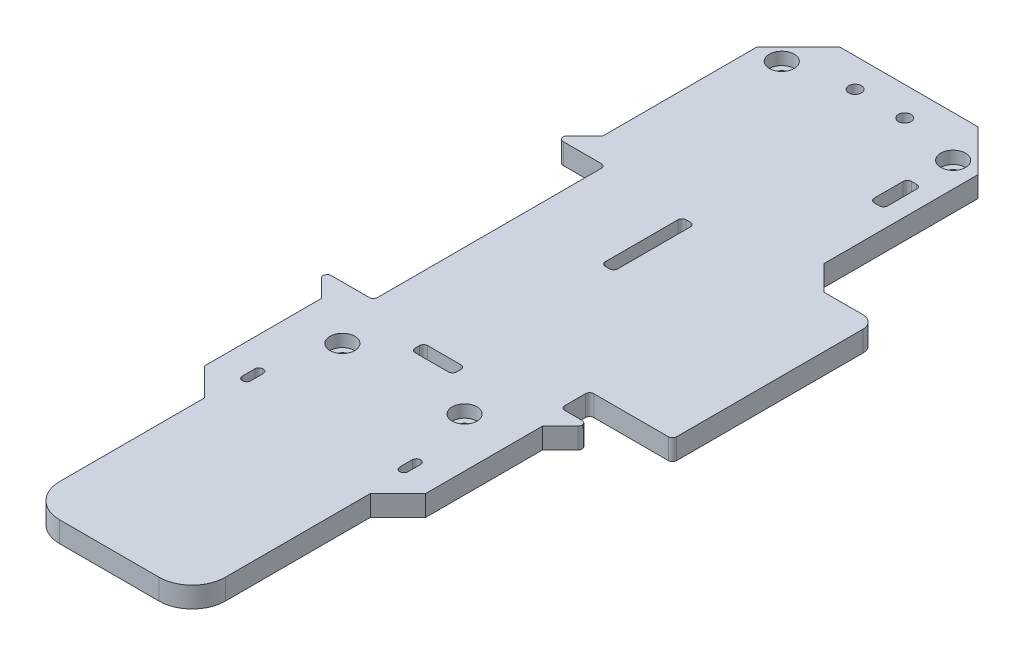
from build123d import *

# Parameters (mm, degrees)
SKETCH1_R           = 1.525
SKETCH1_W           = 3
SKETCH1_H           = 19.5
BOSS_EXTRUDE1_DEPTH = 5
FILLET4_R           = 3
FILLET5_R           = 1
SKETCH4_R           = 3
CUT_EXTRUDE1_DEPTH  = 3
FILLET6_R           = 8
SKETCH6_R           = 19.727216355
CUT_EXTRUDE2_DEPTH  = 6
SKETCH9_R           = 9
CUT_EXTRUDE3_DEPTH  = 8.5
SKETCH11_W          = 2
SKETCH11_H          = 5
SKETCH11_W_2        = 10
SKETCH11_H_2        = 3
CUT_EXTRUDE4_DEPTH  = 6
FILLET7_R           = 1
SKETCH13_R          = 1.525
SKETCH13_W          = 3.25
SKETCH13_H          = 9
CUT_EXTRUDE5_DEPTH  = 6
FILLET8_R           = 1


with BuildPart() as part:
    # Sketch1 → Boss-Extrude1 (new body)
    with BuildSketch(Plane(origin=(0, 0, 0), x_dir=(1, 0, 0), z_dir=(0, 1, 0))):
        Polygon((-26.68337521, 71.16), (-26.68337521, 34), (-32.68337521, 28), (-20.1, 28), (-20.1, -28), (-32.68337521, -28), (-26.68337521, -34), (-26.68337521, -62.15662479), (-20, -68.84), (-20, -111.84), (20, -111.84), (20, -68.84), (26.68337521, -62.15662479), (26.68337521, -34), (32.68337521, -28), (25.1, -28), (25.1, -21), (45.1, -21), (45.1, 28), (32.68337521, 28), (26.68337521, 34), (26.68337521, 71.16), (16.68337521, 81.16), (-16.68337521, 81.16), align=None)
        with Locations(Location((-20.68337521, 71.16, 0), (0, 0, 270))):
            Circle(SKETCH1_R, mode=Mode.SUBTRACT)
        with Locations(Location((20.68337521, 71.16, 0), (0, 0, 270))):
            Circle(SKETCH1_R, mode=Mode.SUBTRACT)
        with Locations((1.4, 16.75)):
            Rectangle(SKETCH1_W, SKETCH1_H, mode=Mode.SUBTRACT)
        with Locations(Location((14.75, -40.84, 0), (0, 0, 270))):
            Circle(SKETCH1_R, mode=Mode.SUBTRACT)
        with Locations(Location((-14.75, -40.84, 0), (0, 0, 270))):
            Circle(SKETCH1_R, mode=Mode.SUBTRACT)
    extrude(amount=BOSS_EXTRUDE1_DEPTH)

    # Fillet4
    fillet4_edges = [part.edges().sort_by_distance(p)[0] for p in [
        (45.1, 2.5, -28),
    ]]
    fillet(fillet4_edges, radius=FILLET4_R)

    # Fillet5
    fillet5_edges = [part.edges().sort_by_distance(p)[0] for p in [
        (-0.1, 2.5, -26.5),
        (-0.1, 2.5, -7),
        (2.9, 2.5, -7),
        (2.9, 2.5, -26.5),
        (45.1, 2.5, 21),
        (25.1, 2.5, 21),
        (25.1, 2.5, 28),
        (32.68337521, 2.5, 28),
        (-32.68337521, 2.5, 28),
        (-20.1, 2.5, 28),
        (-20.1, 2.5, -28),
        (-32.68337521, 2.5, -28),
    ]]
    fillet(fillet5_edges, radius=FILLET5_R)

    # Sketch4 → Cut-Extrude1 (cut)
    with BuildSketch(Plane(origin=(0, 5, 0), x_dir=(1, 0, 0), z_dir=(0, 1, 0))):
        with Locations(Location((-20.68337521, 71.16, 0), (0, 0, 270))):
            Circle(SKETCH4_R)
        with Locations(Location((20.68337521, 71.16, 0), (0, 0, 270))):
            Circle(SKETCH4_R)
        with Locations(Location((-14.75, -40.84, 0), (0, 0, 270))):
            Circle(SKETCH4_R)
        with Locations(Location((14.75, -40.84, 0), (0, 0, 270))):
            Circle(SKETCH4_R)
    extrude(amount=-CUT_EXTRUDE1_DEPTH, mode=Mode.SUBTRACT)

    # Fillet6
    fillet6_edges = [part.edges().sort_by_distance(p)[0] for p in [
        (20, 2.5, 111.84),
        (-20, 2.5, 111.84),
    ]]
    fillet(fillet6_edges, radius=FILLET6_R)

    # Sketch6 → Cut-Extrude2 (cut)
    with BuildSketch(Plane(origin=(12.2, 0, 0), x_dir=(0, 0, -1), z_dir=(1, 0, 0))):
        with Locations((-83.11, -17)):
            Circle(SKETCH6_R)
    extrude(amount=-CUT_EXTRUDE2_DEPTH, mode=Mode.SUBTRACT)

    # Sketch9 → Cut-Extrude3 (cut)
    with BuildSketch(Plane(origin=(0, 0, -46.16), x_dir=(-1, 0, 0), z_dir=(0, 0, -1))):
        with Locations((0.16337521, -7.9)):
            Circle(SKETCH9_R)
    extrude(amount=-CUT_EXTRUDE3_DEPTH, mode=Mode.SUBTRACT)

    # Sketch11 → Cut-Extrude4 (cut)
    with BuildSketch(Plane(origin=(0, 5, 0), x_dir=(1, 0, 0), z_dir=(0, 1, 0))):
        with Locations((-19, -58.219322965)):
            Rectangle(SKETCH11_W, SKETCH11_H)
        with Locations((19, -58.219322965)):
            Rectangle(SKETCH11_W, SKETCH11_H)
        with Locations((0, -32.5)):
            Rectangle(SKETCH11_W_2, SKETCH11_H_2)
    extrude(amount=-CUT_EXTRUDE4_DEPTH, mode=Mode.SUBTRACT)

    # Fillet7
    fillet7_edges = [part.edges().sort_by_distance(p)[0] for p in [
        (-18, 2.5, 55.719322965),
        (-20, 2.5, 55.719322965),
        (-18, 2.5, 60.719322965),
        (-20, 2.5, 60.719322965),
        (20, 2.5, 60.719322965),
        (18, 2.5, 60.719322965),
        (18, 2.5, 55.719322965),
        (20, 2.5, 55.719322965),
        (5, 2.5, 31),
        (5, 2.5, 34),
        (-5, 2.5, 34),
        (-5, 2.5, 31),
    ]]
    fillet(fillet7_edges, radius=FILLET7_R - 0.0001)  # a hair under: the kernel refuses the full size

    # Sketch13 → Cut-Extrude5 (cut)
    with BuildSketch(Plane(origin=(0, 5, 0), x_dir=(1, 0, 0), z_dir=(0, 1, 0))):
        with Locations(Location((-6, 74.16, 0), (0, 0, 270))):
            Circle(SKETCH13_R)
        with Locations(Location((6, 74.16, 0), (0, 0, 270))):
            Circle(SKETCH13_R)
        with Locations((20.68337521, 57.226482401)):
            Rectangle(SKETCH13_W, SKETCH13_H)
    extrude(amount=-CUT_EXTRUDE5_DEPTH, mode=Mode.SUBTRACT)

    # Fillet8
    fillet8_edges = [part.edges().sort_by_distance(p)[0] for p in [
        (22.30837521, 2.5, -61.726482401),
        (22.30837521, 2.5, -52.726482401),
        (19.05837521, 2.5, -52.726482401),
        (19.05837521, 2.5, -61.726482401),
    ]]
    fillet(fillet8_edges, radius=FILLET8_R)


solid = part.part
